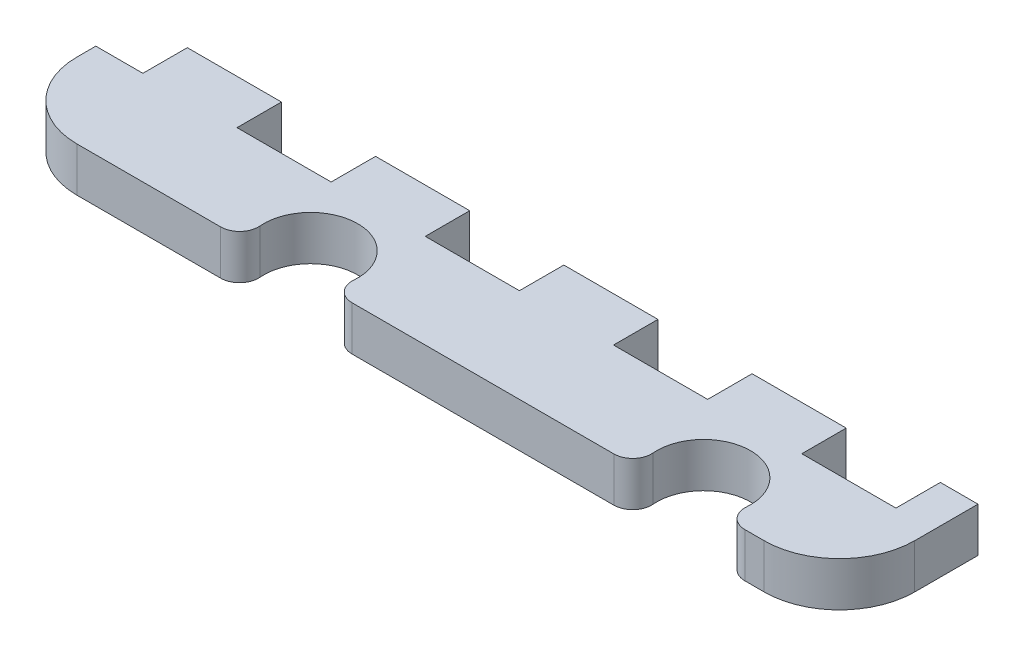
from build123d import *

# Parameters (mm, degrees)
BOSS_EXTRUDE1_DEPTH = 5.9944


with BuildPart() as part:
    # Sketch1 → Boss-Extrude1 (new body)
    with BuildSketch(Plane(origin=(0, 0, 0), x_dir=(1, 0, 0), z_dir=(0, 1, 0))):
        with BuildLine():
            Line((0, 0), (12.7, 0))
            Line((12.7, 0), (12.7, -5.9944))
            Line((12.7, -5.9944), (25.4, -5.9944))
            Line((25.4, -5.9944), (25.4, 0))
            Line((25.4, 0), (38.1, 0))
            Line((38.1, 0), (38.1, -5.9944))
            Line((38.1, -5.9944), (50.8, -5.9944))
            Line((50.8, -5.9944), (50.8, 0))
            Line((50.8, 0), (63.5, 0))
            Line((63.5, 0), (63.5, -5.9944))
            Line((63.5, -5.9944), (76.2, -5.9944))
            Line((76.2, -5.9944), (76.2, 0))
            Line((76.2, 0), (88.9, 0))
            Line((88.9, 0), (88.9, -5.9944))
            Line((88.9, -5.9944), (101.6, -5.9944))
            Line((101.6, -5.9944), (101.6, 0))
            Line((101.6, 0), (106.68, 0))
            Line((106.68, 0), (106.68, -5.9944))
            Line((106.68, -5.9944), (106.68, -8.5344))
            ThreePointArc((106.68, -8.5344), (103.704204897, -15.718604897), (96.52, -18.6944))
            Line((96.52, -18.6944), (93.916902138, -18.6944))
            ThreePointArc((93.916902138, -18.6944), (92.047703361, -17.874195317), (91.385690089, -15.943294434))
            ThreePointArc((91.385690089, -15.943294434), (85.08067506, -9.090545), (78.775660031, -15.943294434))
            ThreePointArc((78.775660031, -15.943294434), (78.113646759, -17.874195317), (76.244447982, -18.6944))
            Line((76.244447982, -18.6944), (40.920907051, -18.6944))
            ThreePointArc((40.920907051, -18.6944), (39.051894592, -17.874397799), (38.389649322, -15.943842857))
            ThreePointArc((38.389649322, -15.943842857), (32.061505, -9.06745), (25.733360678, -15.943842857))
            ThreePointArc((25.733360678, -15.943842857), (25.071115408, -17.874397799), (23.202102949, -18.6944))
            Line((23.202102949, -18.6944), (3.81, -18.6944))
            ThreePointArc((3.81, -18.6944), (-3.374204897, -15.718604897), (-6.35, -8.5344))
            Line((-6.35, -8.5344), (-6.35, -5.9944))
            Line((-6.35, -5.9944), (0, -5.9944))
            Line((0, -5.9944), (0, 0))
        make_face()
    extrude(amount=BOSS_EXTRUDE1_DEPTH)


solid = part.part
